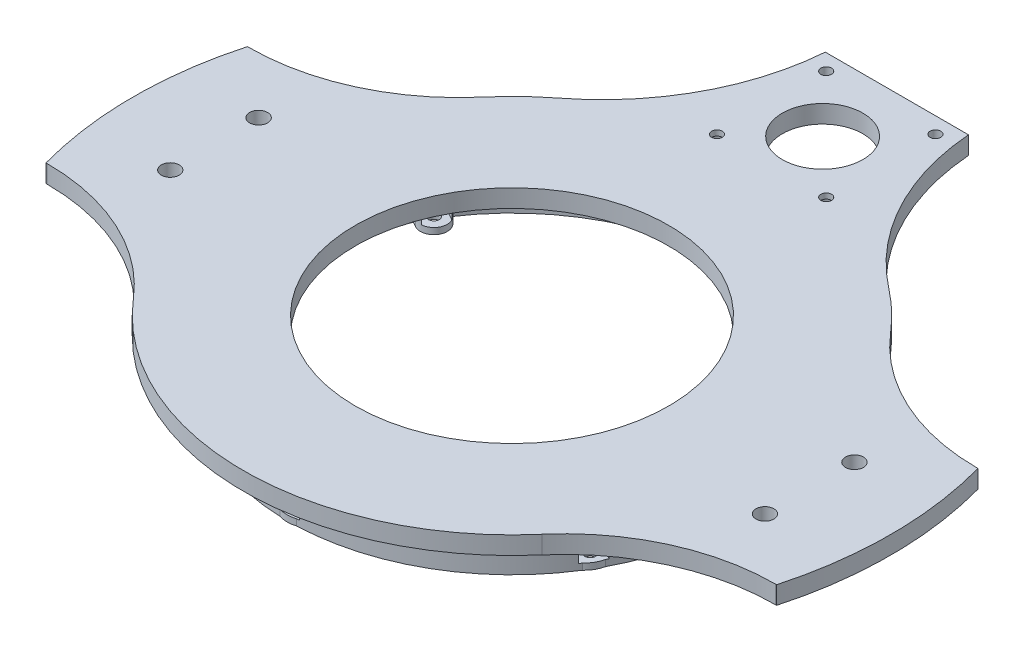
from build123d import *

# Parameters (mm, degrees)
SKETCH1_R            = 76.2
SKETCH1_R_2          = 44.45
BOSS_EXTRUDE1_DEPTH  = 5.08
BOSS_EXTRUDE12_DEPTH = 5.08
SKETCH7_R            = 44.45
BOSS_EXTRUDE13_DEPTH = 5.08
SKETCH8_R            = 2.54
CUT_EXTRUDE1_DEPTH   = 132.886411546
SKETCH11_R           = 2.55773741
SKETCH11_R_2         = 2.443934978
SKETCH11_R_3         = 2.44571327
SKETCH11_R_4         = 2.563372012
CUT_EXTRUDE2_DEPTH   = 132.886411546
SKETCH12_R           = 63.5
SKETCH12_R_2         = 62.23
BOSS_EXTRUDE15_DEPTH = 13.716
SKETCH13_R           = 66.04
SKETCH13_R_2         = 63.5
BOSS_EXTRUDE16_DEPTH = 3.81
SKETCH14_W           = 40.64
SKETCH14_H           = 44.45
SKETCH14_R           = 11.43
BOSS_EXTRUDE17_DEPTH = 5.08
CUT_EXTRUDE3_START   = -5.08
SKETCH15_R           = 11.43
SKETCH15_R_2         = 1.524
CUT_EXTRUDE3_DEPTH   = 5.08
BOSS_EXTRUDE19_DEPTH = 13.716
SKETCH18_R           = 1.524
BOSS_EXTRUDE20_DEPTH = 13.716
SKETCH19_W           = 6.35
SKETCH19_H           = 2.794
CUT_EXTRUDE4_DEPTH   = 15.24
CIRPATTERN1_COUNT    = 6
SKETCH21_R           = 3.048
CUT_EXTRUDE6_DEPTH   = 3.556
FILLET2_R            = 68.58


with BuildPart() as part:
    # Sketch1 → Boss-Extrude1 (new body)
    with BuildSketch(Plane(origin=(0, 0, 0), x_dir=(1, 0, 0), z_dir=(0, 1, 0))):
        with Locations(Location((0, 0, 0), (0, 0, 270))):
            Circle(SKETCH1_R)
        with Locations(Location((0, 0, 0), (0, 0, 270))):
            Circle(SKETCH1_R_2, mode=Mode.SUBTRACT)
    extrude(amount=BOSS_EXTRUDE1_DEPTH)

    # Sketch6 → Boss-Extrude12 (add, through all)
    with BuildSketch(Plane(origin=(0, 5.08, 0), x_dir=(1, 0, 0), z_dir=(0, 1, 0))):
        with BuildLine():
            Line((-103.65929059, 28.575), (-70.63929059, 28.575))
            ThreePointArc((-70.63929059, 28.575), (-76.2, 0), (-70.63929059, -28.575))
            Line((-70.63929059, -28.575), (-103.65929059, -28.575))
            ThreePointArc((-103.65929059, -28.575), (-107.525713904, 0), (-103.65929059, 28.575))
        make_face()
        with BuildLine():
            Line((103.65929059, -28.575), (70.63929059, -28.575))
            ThreePointArc((70.63929059, -28.575), (76.2, 0), (70.63929059, 28.575))
            Line((70.63929059, 28.575), (103.65929059, 28.575))
            ThreePointArc((103.65929059, 28.575), (107.525713904, 0), (103.65929059, -28.575))
        make_face()
    extrude(amount=-BOSS_EXTRUDE12_DEPTH)

    # Sketch7 → Boss-Extrude13 (add, through all)
    with BuildSketch(Plane(origin=(0, 5.08, 0), x_dir=(1, 0, 0), z_dir=(0, 1, 0))):
        with BuildLine():
            Line((-103.65929059, 28.575), (-103.321739605, 28.575))
            ThreePointArc((-103.321739605, 28.575), (-78.334957702, 34.056542817), (-57.937424078, 49.494392523))
            ThreePointArc((-57.937424078, 49.494392523), (0, 76.2), (57.937424078, 49.494392523))
            ThreePointArc((57.937424078, 49.494392523), (78.334957702, 34.056542817), (103.321739605, 28.575))
            Line((103.321739605, 28.575), (103.65929059, 28.575))
            Line((103.65929059, 28.575), (103.65929059, -28.575))
            Line((103.65929059, -28.575), (103.321739605, -28.575))
            ThreePointArc((103.321739605, -28.575), (78.334957702, -34.056542817), (57.937424078, -49.494392523))
            ThreePointArc((57.937424078, -49.494392523), (0, -76.2), (-57.937424078, -49.494392523))
            ThreePointArc((-57.937424078, -49.494392523), (-78.334957702, -34.056542817), (-103.321739605, -28.575))
            Line((-103.321739605, -28.575), (-103.65929059, -28.575))
            Line((-103.65929059, -28.575), (-103.65929059, 28.575))
        make_face()
        with Locations(Location((0, 0, 0), (0, 0, 270))):
            Circle(SKETCH7_R, mode=Mode.SUBTRACT)
    extrude(amount=-BOSS_EXTRUDE13_DEPTH)

    # Sketch8 → Cut-Extrude1 (cut, through all)
    with BuildSketch(Plane(origin=(0, 5.08, 0), x_dir=(1, 0, 0), z_dir=(0, 1, 0))):
        with Locations(Location((-84.60929059, 12.7, 0), (0, 0, 270))):
            Circle(SKETCH8_R)
        with Locations(Location((-84.271739605, -12.7, 0), (0, 0, 270))):
            Circle(SKETCH8_R)
        with Locations(Location((84.60929059, 12.573, 0), (0, 0, 270))):
            Circle(SKETCH8_R)
        with Locations(Location((84.60929059, -12.827, 0), (0, 0, 270))):
            Circle(SKETCH8_R)
    extrude(amount=-CUT_EXTRUDE1_DEPTH, mode=Mode.SUBTRACT)

    # Sketch11 → Cut-Extrude2 (cut, through all)
    with BuildSketch(Plane.XZ):
        with Locations(Location((84.60929059, -12.573, 0), (0, 0, 270))):
            Circle(SKETCH11_R)
        with Locations((84.60929059, 12.827)):
            Circle(SKETCH11_R_2)
        with Locations((-84.271739605, 12.7)):
            Circle(SKETCH11_R_3)
        with Locations(Location((-84.60929059, -12.7, 0), (0, 0, 270))):
            Circle(SKETCH11_R_4)
    extrude(amount=-CUT_EXTRUDE2_DEPTH, mode=Mode.SUBTRACT)

    # Sketch12 → Boss-Extrude15 (add)
    with BuildSketch(Plane.XZ):
        with Locations(Location((0, 0, 0), (0, 0, 90))):
            Circle(SKETCH12_R)
        with Locations(Location((0, 0, 0), (0, 0, 270))):
            Circle(SKETCH12_R_2, mode=Mode.SUBTRACT)
    extrude(amount=BOSS_EXTRUDE15_DEPTH)

    # Sketch13 → Boss-Extrude16 (add)
    with BuildSketch(Plane.XZ):
        with Locations(Location((0, 0, 0), (0, 0, 90))):
            Circle(SKETCH13_R)
        with Locations(Location((0, 0, 0), (0, 0, 270))):
            Circle(SKETCH13_R_2, mode=Mode.SUBTRACT)
    extrude(amount=BOSS_EXTRUDE16_DEPTH)

    # Sketch14 → Boss-Extrude17 (add)
    with BuildSketch(Plane.XZ):
        with Locations((0, -86.995)):
            Rectangle(SKETCH14_W, SKETCH14_H)
        with Locations(Location((0, -88.138, 0), (0, 0, 270))):
            Circle(SKETCH14_R, mode=Mode.SUBTRACT)
    extrude(amount=-BOSS_EXTRUDE17_DEPTH)

    # Sketch15 → Cut-Extrude3 (cut)
    with BuildSketch(Plane(origin=(0, 5.08, 0), x_dir=(1, 0, 0), z_dir=(0, 1, 0)).offset(CUT_EXTRUDE3_START)):
        with Locations(Location((0, 88.138, 0), (0, 0, 90))):
            Circle(SKETCH15_R)
        with Locations(Location((-15.494, 104.648, 0), (0, 0, 270))):
            Circle(SKETCH15_R_2)
        with Locations(Location((15.494, 104.648, 0), (0, 0, 270))):
            Circle(SKETCH15_R_2)
        with Locations(Location((15.494, 73.66, 0), (0, 0, 270))):
            Circle(SKETCH15_R_2)
        with Locations(Location((-15.494, 73.66, 0), (0, 0, 270))):
            Circle(SKETCH15_R_2)
    extrude(amount=CUT_EXTRUDE3_DEPTH, mode=Mode.SUBTRACT)

    # Sketch17 → Boss-Extrude19 (add, through all)
    with BuildSketch(Plane.XZ):
        with BuildLine():
            ThreePointArc((53.768378144, -33.781822209), (54.99261314, -31.75), (56.140105291, -29.673870289))
            ThreePointArc((56.140105291, -29.673870289), (55.268247185, -31.90913739), (53.768378144, -33.781822209))
        make_face()
        with BuildLine():
            ThreePointArc((2.371727147, -63.455692498), (0, -63.81827478), (-2.371727147, -63.455692498))
            ThreePointArc((-2.371727147, -63.455692498), (0, -63.5), (2.371727147, -63.455692498))
        make_face()
        with BuildLine():
            ThreePointArc((-53.768378144, -33.781822209), (-55.268247185, -31.90913739), (-56.140105291, -29.673870289))
            ThreePointArc((-56.140105291, -29.673870289), (-54.99261314, -31.75), (-53.768378144, -33.781822209))
        make_face()
        with BuildLine():
            ThreePointArc((-56.140105291, 29.673870289), (-55.268247185, 31.90913739), (-53.768378144, 33.781822209))
            ThreePointArc((-53.768378144, 33.781822209), (-54.99261314, 31.75), (-56.140105291, 29.673870289))
        make_face()
        with BuildLine():
            ThreePointArc((-2.371727147, 63.455692498), (0, 63.81827478), (2.371727147, 63.455692498))
            ThreePointArc((2.371727147, 63.455692498), (0, 63.5), (-2.371727147, 63.455692498))
        make_face()
        with BuildLine():
            ThreePointArc((53.768378144, 33.781822209), (55.268247185, 31.90913739), (56.140105291, 29.673870289))
            ThreePointArc((56.140105291, 29.673870289), (54.99261314, 31.75), (53.768378144, 33.781822209))
        make_face()
    extrude(amount=BOSS_EXTRUDE19_DEPTH)

    # Sketch18 → Boss-Extrude20 (add, through all)
    # profile 1 of 6: a face of its own
    with BuildSketch(Plane.XZ):
        with BuildLine():
            Line((-3.81, -60.579), (-3.81, -62.113257844))
            ThreePointArc((-3.81, -62.113257844), (0, -62.23), (3.81, -62.113257844))
            Line((3.81, -62.113257844), (3.81, -60.579))
            ThreePointArc((3.81, -60.579), (0, -56.769), (-3.81, -60.579))
        make_face()
        with Locations(Location((0, -60.579, 0), (0, 0, 270))):
            Circle(SKETCH18_R, mode=Mode.SUBTRACT)
    # profile 2 of 6: a face of its own
    with BuildSketch(Plane.XZ):
        with BuildLine():
            Line((-54.367952936, -26.989943212), (-55.696659205, -27.757072134))
            ThreePointArc((-55.696659205, -27.757072134), (-53.892760878, -31.115), (-51.886659205, -34.35618571))
            Line((-51.886659205, -34.35618571), (-50.557952936, -33.589056788))
            ThreePointArc((-50.557952936, -33.589056788), (-49.163396147, -28.3845), (-54.367952936, -26.989943212))
        make_face()
        with Locations(Location((-52.462952936, -30.2895, 0), (0, 0, 270))):
            Circle(SKETCH18_R, mode=Mode.SUBTRACT)
    # profile 3 of 6: a face of its own
    with BuildSketch(Plane.XZ):
        with BuildLine():
            Line((-50.557952936, 33.589056788), (-51.886659205, 34.35618571))
            ThreePointArc((-51.886659205, 34.35618571), (-53.892760878, 31.115), (-55.696659205, 27.757072134))
            Line((-55.696659205, 27.757072134), (-54.367952936, 26.989943212))
            ThreePointArc((-54.367952936, 26.989943212), (-49.163396147, 28.3845), (-50.557952936, 33.589056788))
        make_face()
        with Locations(Location((-52.462952936, 30.2895, 0), (0, 0, 270))):
            Circle(SKETCH18_R, mode=Mode.SUBTRACT)
    # profile 4 of 6: a face of its own
    with BuildSketch(Plane.XZ):
        with BuildLine():
            Line((3.81, 60.579), (3.81, 62.113257844))
            ThreePointArc((3.81, 62.113257844), (0, 62.23), (-3.81, 62.113257844))
            Line((-3.81, 62.113257844), (-3.81, 60.579))
            ThreePointArc((-3.81, 60.579), (0, 56.769), (3.81, 60.579))
        make_face()
        with Locations(Location((0, 60.579, 0), (0, 0, 270))):
            Circle(SKETCH18_R, mode=Mode.SUBTRACT)
    # profile 5 of 6: a face of its own
    with BuildSketch(Plane.XZ):
        with BuildLine():
            Line((54.367952936, 26.989943212), (55.696659205, 27.757072134))
            ThreePointArc((55.696659205, 27.757072134), (53.892760878, 31.115), (51.886659205, 34.35618571))
            Line((51.886659205, 34.35618571), (50.557952936, 33.589056788))
            ThreePointArc((50.557952936, 33.589056788), (49.163396147, 28.3845), (54.367952936, 26.989943212))
        make_face()
        with Locations(Location((52.462952936, 30.2895, 0), (0, 0, 270))):
            Circle(SKETCH18_R, mode=Mode.SUBTRACT)
    # profile 6 of 6: a face of its own
    with BuildSketch(Plane.XZ):
        with BuildLine():
            Line((50.557952936, -33.589056788), (51.886659205, -34.35618571))
            ThreePointArc((51.886659205, -34.35618571), (53.892760878, -31.115), (55.696659205, -27.757072134))
            Line((55.696659205, -27.757072134), (54.367952936, -26.989943212))
            ThreePointArc((54.367952936, -26.989943212), (49.163396147, -28.3845), (50.557952936, -33.589056788))
        make_face()
        with Locations(Location((52.462952936, -30.2895, 0), (0, 0, 270))):
            Circle(SKETCH18_R, mode=Mode.SUBTRACT)
    extrude(amount=BOSS_EXTRUDE20_DEPTH)

    # Sketch19 → Cut-Extrude4 (cut, symmetric)
    with BuildSketch(Plane.XY.offset(-62.113257844)):
        with Locations((0, -10.541)):
            Rectangle(SKETCH19_W, SKETCH19_H)
    cut_extrude4 = extrude(amount=CUT_EXTRUDE4_DEPTH, both=True, mode=Mode.SUBTRACT)

    # CirPattern1: Cut-Extrude4 ×6 about axis
    cirpattern1_axis = Axis((0, 0, 0), (0, 1, 0))
    for i in range(1, CIRPATTERN1_COUNT):
        add(cut_extrude4.rotate(cirpattern1_axis, i * 360 / CIRPATTERN1_COUNT), mode=Mode.SUBTRACT)

    # Sketch21 → Cut-Extrude6 (cut)
    with BuildSketch(Plane.XZ):
        with Locations(Location((15.494, -73.66, 0), (0, 0, 270))):
            Circle(SKETCH21_R)
        with Locations(Location((-15.494, -73.66, 0), (0, 0, 270))):
            Circle(SKETCH21_R)
    extrude(amount=-CUT_EXTRUDE6_DEPTH, mode=Mode.SUBTRACT)

    # Fillet2
    # the kernel refuses this fillet: 68.58 mm, written as the material it adds along each edge
    with BuildSketch(Plane(origin=(20.32, 0, -73.440708058), x_dir=(0.8939637768397252, 0, 0.44813922579757975), z_dir=(0, 1, 0))) as fillet2_piece_1:
        with BuildLine():
            CenterArc((42.764322506, 67.283569635), FILLET2_R, 210.97745601, 47.8641928)
            Line((-16.034104191, 31.985390957), (-17.210072725, 31.279427384))
            ThreePointArc((-17.210072725, 31.279427384), (-9.243212812, 15.378027717), (-1.226160716, -0.614667762))
            Line((-1.226160716, -0.614667762), (0.265433726, -1.345671393))
            ThreePointArc((0.265433726, -1.345671393), (14.746318106, 0.068878183), (29.227202485, -1.345671393))
            Line((29.227202485, -1.345671393), (29.492636211, 0))
        make_face()
    extrude(amount=5.08)
    with BuildSketch(Plane(origin=(-20.32, 0, -73.440708058), x_dir=(0, 0, -1), z_dir=(0, 1, 0))) as fillet2_piece_2:
        with BuildLine():
            CenterArc((40.984703651, 68.382162067), FILLET2_R, 217.782712335, 47.8641928)
            Line((-13.216807158, 26.365348456), (-14.300837375, 25.525012184))
            ThreePointArc((-14.300837375, 25.525012184), (-6.546828979, 13.213541244), (-1.321932745, -0.36576))
            Line((-1.321932745, -0.36576), (0, -1.3716))
            ThreePointArc((0, -1.3716), (17.889645971, -1.3716), (35.675183708, -1.367643241))
            Line((35.675183708, -1.367643241), (35.779291942, 0))
        make_face()
    extrude(amount=5.08)


solid = part.part
